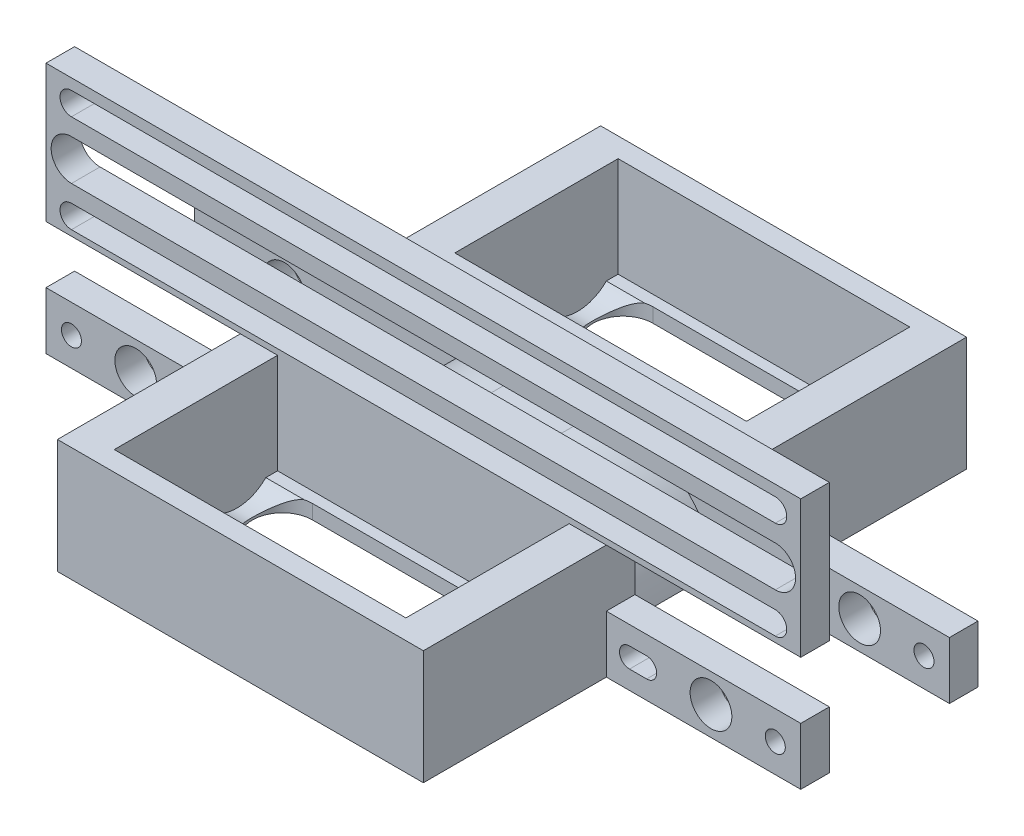
from build123d import *

# Parameters (mm, degrees)
SKETCH1_W                 = 51
SKETCH1_H                 = 28.56
TOTALHEIGHT_DEPTH         = 20
TOTALHEIGHT_2_DEPTH       = 20
SKETCH1_4_W               = 51
SKETCH1_4_H               = 21
MIDDLEFLOORHEIGHT_DEPTH   = 15
SKETCH1_3_W               = 51
SKETCH1_3_H               = 28.56
FLOORHEIGHT_DEPTH         = 2.5
DIPSFORBATTERY_REACH      = 135.406
SKETCH2_4_W               = 34
SKETCH2_4_H               = 10
SKETCH2_4_R               = 1.75
SKETCH2_4_R_2             = 3.65
MOUNTFORDRIVETRAIN_DEPTH  = 5
HOLESFORDRIVESHAFT_REACH  = 154.738
SKETCH2_R                 = 1.75
SKETCH2_R_2               = 3.65
FILLET1_R                 = 20
SLOTSFORPLASTICBARS_REACH = 154.738
SKETCH2_6_W               = 34
SKETCH2_6_H               = 10


with BuildPart() as part:
    # Sketch1 → TotalHeight (new body)
    with BuildSketch(Plane(origin=(0, 0, 0), x_dir=(1, 0, 0), z_dir=(0, 1, 0))):
        Polygon((34, 32), (34, 0), (98, 0), (98, 32), (132, 32), (132, 37), (0, 37), (0, 32), align=None)
        with Locations((66, 17.72)):
            Rectangle(SKETCH1_W, SKETCH1_H, mode=Mode.SUBTRACT)
    extrude(amount=TOTALHEIGHT_DEPTH)



with BuildPart() as body_2:
    # Sketch1 → TotalHeight 2 (new body)
    with BuildSketch(Plane(origin=(0, 0, 0), x_dir=(1, 0, 0), z_dir=(0, 1, 0))):
        Polygon((0, 63), (0, 58), (132, 58), (132, 63), (98, 63), (98, 95), (34, 95), (34, 63), align=None)
        with Locations((66, 77.28)):
            Rectangle(SKETCH1_W, SKETCH1_H, mode=Mode.SUBTRACT)
    extrude(amount=TOTALHEIGHT_2_DEPTH)


with BuildPart() as part_1:
    add(part.part)

    add(body_2.part)  # MiddleFloorHeight merges body 2
    # Sketch1<4> → MiddleFloorHeight (add)
    with BuildSketch(Plane(origin=(0, 0, 0), x_dir=(1, 0, 0), z_dir=(0, 1, 0))):
        with Locations((66, 47.5)):
            Rectangle(SKETCH1_4_W, SKETCH1_4_H)
    extrude(amount=MIDDLEFLOORHEIGHT_DEPTH)

    # Sketch1<3> → FloorHeight (add)
    # profile 1 of 2: a face of its own
    with BuildSketch(Plane(origin=(0, 0, 0), x_dir=(1, 0, 0), z_dir=(0, 1, 0))):
        with Locations((66, 77.28)):
            Rectangle(SKETCH1_3_W, SKETCH1_3_H)
        with BuildLine():
            ThreePointArc((83.5, 79.17), (88.75, 84.42), (83.5, 89.67))
            Line((83.5, 89.67), (48.5, 89.67))
            ThreePointArc((48.5, 89.67), (43.25, 84.42), (48.5, 79.17))
            Line((48.5, 79.17), (83.5, 79.17))
        make_face(mode=Mode.SUBTRACT)
        with BuildLine():
            Line((48.5, 75.39), (83.5, 75.39))
            ThreePointArc((83.5, 75.39), (88.75, 70.14), (83.5, 64.89))
            Line((83.5, 64.89), (48.5, 64.89))
            ThreePointArc((48.5, 64.89), (43.25, 70.14), (48.5, 75.39))
        make_face(mode=Mode.SUBTRACT)
    # profile 2 of 2: a face of its own
    with BuildSketch(Plane(origin=(0, 0, 0), x_dir=(1, 0, 0), z_dir=(0, 1, 0))):
        with Locations((66, 17.72)):
            Rectangle(SKETCH1_3_W, SKETCH1_3_H)
        with BuildLine():
            ThreePointArc((83.5, 19.61), (88.75, 24.86), (83.5, 30.11))
            Line((83.5, 30.11), (48.5, 30.11))
            ThreePointArc((48.5, 30.11), (43.25, 24.86), (48.5, 19.61))
            Line((48.5, 19.61), (83.5, 19.61))
        make_face(mode=Mode.SUBTRACT)
        with BuildLine():
            Line((48.5, 15.83), (83.5, 15.83))
            ThreePointArc((83.5, 15.83), (88.75, 10.58), (83.5, 5.33))
            Line((83.5, 5.33), (48.5, 5.33))
            ThreePointArc((48.5, 5.33), (43.25, 10.58), (48.5, 15.83))
        make_face(mode=Mode.SUBTRACT)
    extrude(amount=FLOORHEIGHT_DEPTH)

    # DipsForBattery: up to this face of the body (flat: up to its plane)
    dipsforbattery_end = Plane(part_1.part.faces().sort_by_distance((40.5, 11.25, -77.28))[0])
    # Sketch3 → DipsForBattery (cut, up to the picked face)
    with BuildSketch(Plane.ZY.offset(-91.5), mode=Mode.PRIVATE) as dipsforbattery_sk1:
        with BuildLine():
            ThreePointArc((-77.36, 7.5), (-87.163708918, 14.065055833), (-89.500833264, 2.5))
            Line((-89.500833264, 2.5), (-79.419166736, 2.5))
            ThreePointArc((-79.419166736, 2.5), (-77.894944167, 4.796291082), (-77.36, 7.5))
        make_face()
    dipsforbattery_tool1 = split(extrude(dipsforbattery_sk1.sketch, amount=DIPSFORBATTERY_REACH, mode=Mode.PRIVATE), bisect_by=dipsforbattery_end, keep=Keep.BOTH, mode=Mode.PRIVATE)
    # Sketch3 → DipsForBattery (cut, up to the picked face)
    with BuildSketch(Plane.ZY.offset(-91.5), mode=Mode.PRIVATE) as dipsforbattery_sk2:
        with BuildLine():
            Line((-79.419166736, 2.5), (-89.500833264, 2.5))
            ThreePointArc((-89.500833264, 2.5), (-84.46, 0.4), (-79.419166736, 2.5))
        make_face()
    dipsforbattery_tool2 = split(extrude(dipsforbattery_sk2.sketch, amount=DIPSFORBATTERY_REACH, mode=Mode.PRIVATE), bisect_by=dipsforbattery_end, keep=Keep.BOTH, mode=Mode.PRIVATE)
    # Sketch3 → DipsForBattery (cut, up to the picked face)
    with BuildSketch(Plane.ZY.offset(-91.5), mode=Mode.PRIVATE) as dipsforbattery_sk3:
        with BuildLine():
            ThreePointArc((-63, 7.5), (-72.803708918, 14.065055833), (-75.140833264, 2.5))
            Line((-75.140833264, 2.5), (-65.059166736, 2.5))
            ThreePointArc((-65.059166736, 2.5), (-63.534944167, 4.796291082), (-63, 7.5))
        make_face()
    dipsforbattery_tool3 = split(extrude(dipsforbattery_sk3.sketch, amount=DIPSFORBATTERY_REACH, mode=Mode.PRIVATE), bisect_by=dipsforbattery_end, keep=Keep.BOTH, mode=Mode.PRIVATE)
    # Sketch3 → DipsForBattery (cut, up to the picked face)
    with BuildSketch(Plane.ZY.offset(-91.5), mode=Mode.PRIVATE) as dipsforbattery_sk4:
        with BuildLine():
            Line((-65.059166736, 2.5), (-75.140833264, 2.5))
            ThreePointArc((-75.140833264, 2.5), (-70.1, 0.4), (-65.059166736, 2.5))
        make_face()
    dipsforbattery_tool4 = split(extrude(dipsforbattery_sk4.sketch, amount=DIPSFORBATTERY_REACH, mode=Mode.PRIVATE), bisect_by=dipsforbattery_end, keep=Keep.BOTH, mode=Mode.PRIVATE)
    # Sketch3 → DipsForBattery (cut, up to the picked face)
    with BuildSketch(Plane.ZY.offset(-91.5), mode=Mode.PRIVATE) as dipsforbattery_sk5:
        with BuildLine():
            ThreePointArc((-29.940833264, 2.5), (-24.9, 0.4), (-19.859166736, 2.5))
            Line((-19.859166736, 2.5), (-29.940833264, 2.5))
        make_face()
    dipsforbattery_tool5 = split(extrude(dipsforbattery_sk5.sketch, amount=DIPSFORBATTERY_REACH, mode=Mode.PRIVATE), bisect_by=dipsforbattery_end, keep=Keep.BOTH, mode=Mode.PRIVATE)
    # Sketch3 → DipsForBattery (cut, up to the picked face)
    with BuildSketch(Plane.ZY.offset(-91.5), mode=Mode.PRIVATE) as dipsforbattery_sk6:
        with BuildLine():
            Line((-29.940833264, 2.5), (-19.859166736, 2.5))
            ThreePointArc((-19.859166736, 2.5), (-18.334944167, 4.796291082), (-17.8, 7.5))
            ThreePointArc((-17.8, 7.5), (-27.603708918, 14.065055833), (-29.940833264, 2.5))
        make_face()
    dipsforbattery_tool6 = split(extrude(dipsforbattery_sk6.sketch, amount=DIPSFORBATTERY_REACH, mode=Mode.PRIVATE), bisect_by=dipsforbattery_end, keep=Keep.BOTH, mode=Mode.PRIVATE)
    # Sketch3 → DipsForBattery (cut, up to the picked face)
    with BuildSketch(Plane.ZY.offset(-91.5), mode=Mode.PRIVATE) as dipsforbattery_sk7:
        with BuildLine():
            ThreePointArc((-15.580833264, 2.5), (-10.54, 0.4), (-5.499166736, 2.5))
            Line((-5.499166736, 2.5), (-15.580833264, 2.5))
        make_face()
    dipsforbattery_tool7 = split(extrude(dipsforbattery_sk7.sketch, amount=DIPSFORBATTERY_REACH, mode=Mode.PRIVATE), bisect_by=dipsforbattery_end, keep=Keep.BOTH, mode=Mode.PRIVATE)
    # Sketch3 → DipsForBattery (cut, up to the picked face)
    with BuildSketch(Plane.ZY.offset(-91.5), mode=Mode.PRIVATE) as dipsforbattery_sk8:
        with BuildLine():
            Line((-15.580833264, 2.5), (-5.499166736, 2.5))
            ThreePointArc((-5.499166736, 2.5), (-3.974944167, 4.796291082), (-3.44, 7.5))
            ThreePointArc((-3.44, 7.5), (-13.243708918, 14.065055833), (-15.580833264, 2.5))
        make_face()
    dipsforbattery_tool8 = split(extrude(dipsforbattery_sk8.sketch, amount=DIPSFORBATTERY_REACH, mode=Mode.PRIVATE), bisect_by=dipsforbattery_end, keep=Keep.BOTH, mode=Mode.PRIVATE)
    add(dipsforbattery_tool1.solids().sort_by(Axis((91.5, 8.093926, -84.46), (-1, 0, 0)))[0], mode=Mode.SUBTRACT)
    add(dipsforbattery_tool2.solids().sort_by(Axis((91.5, 1.64835, -84.46), (-1, 0, 0)))[0], mode=Mode.SUBTRACT)
    add(dipsforbattery_tool3.solids().sort_by(Axis((91.5, 8.093926, -70.1), (-1, 0, 0)))[0], mode=Mode.SUBTRACT)
    add(dipsforbattery_tool4.solids().sort_by(Axis((91.5, 1.64835, -70.1), (-1, 0, 0)))[0], mode=Mode.SUBTRACT)
    add(dipsforbattery_tool5.solids().sort_by(Axis((91.5, 1.64835, -24.9), (-1, 0, 0)))[0], mode=Mode.SUBTRACT)
    add(dipsforbattery_tool6.solids().sort_by(Axis((91.5, 8.093926, -24.9), (-1, 0, 0)))[0], mode=Mode.SUBTRACT)
    add(dipsforbattery_tool7.solids().sort_by(Axis((91.5, 1.64835, -10.54), (-1, 0, 0)))[0], mode=Mode.SUBTRACT)
    add(dipsforbattery_tool8.solids().sort_by(Axis((91.5, 8.093926, -10.54), (-1, 0, 0)))[0], mode=Mode.SUBTRACT)

    # Sketch2<4> → MountForDriveTrain (add)
    # profile 1 of 4: a face of its own
    with BuildSketch(Plane.XY.offset(-32)):
        Polygon((0, 44), (0, 20), (34, 20), (98, 20), (132, 20), (132, 44), align=None)
        with BuildLine():
            ThreePointArc((4.45, 28), (0.9, 31.55), (4.45, 35.1))
            Line((4.45, 35.1), (127.55, 35.1))
            ThreePointArc((127.55, 35.1), (131.1, 31.55), (127.55, 28))
            Line((127.55, 28), (4.45, 28))
        make_face(mode=Mode.SUBTRACT)
        with BuildLine():
            ThreePointArc((4.45, 21), (2.45, 23), (4.45, 25))
            Line((4.45, 25), (127.55, 25))
            ThreePointArc((127.55, 25), (129.55, 23), (127.55, 21))
            Line((127.55, 21), (4.45, 21))
        make_face(mode=Mode.SUBTRACT)
        with BuildLine():
            ThreePointArc((4.45, 38.1), (2.45, 40.1), (4.45, 42.1))
            Line((4.45, 42.1), (127.55, 42.1))
            ThreePointArc((127.55, 42.1), (129.55, 40.1), (127.55, 38.1))
            Line((127.55, 38.1), (4.45, 38.1))
        make_face(mode=Mode.SUBTRACT)
    # profile 2 of 4: a face of its own
    with BuildSketch(Plane.XY.offset(-32)):
        with Locations((17, 15)):
            Rectangle(SKETCH2_4_W, SKETCH2_4_H)
    # profile 3 of 4: a face of its own
    with BuildSketch(Plane.XY.offset(-32)):
        Polygon((98, 20), (34, 20), (34, 10), (0, 10), (0, 0), (132, 0), (132, 10), (98, 10), align=None)
        with Locations((4.45, 5)):
            Circle(SKETCH2_4_R, mode=Mode.SUBTRACT)
        with Locations((15.7, 5)):
            Circle(SKETCH2_4_R_2, mode=Mode.SUBTRACT)
        with BuildLine():
            ThreePointArc((26.95, 3.25), (25.2, 5), (26.95, 6.75))
            Line((26.95, 6.75), (29.95, 6.75))
            ThreePointArc((29.95, 6.75), (31.7, 5), (29.95, 3.25))
            Line((29.95, 3.25), (26.95, 3.25))
        make_face(mode=Mode.SUBTRACT)
        with BuildLine():
            Line((102.05, 6.75), (105.05, 6.75))
            ThreePointArc((105.05, 6.75), (106.8, 5), (105.05, 3.25))
            Line((105.05, 3.25), (102.05, 3.25))
            ThreePointArc((102.05, 3.25), (100.3, 5), (102.05, 6.75))
        make_face(mode=Mode.SUBTRACT)
        with Locations((116.3, 5)):
            Circle(SKETCH2_4_R_2, mode=Mode.SUBTRACT)
        with Locations((127.55, 5)):
            Circle(SKETCH2_4_R, mode=Mode.SUBTRACT)
    # profile 4 of 4: a face of its own
    with BuildSketch(Plane.XY.offset(-32)):
        with Locations((115, 15)):
            Rectangle(SKETCH2_4_W, SKETCH2_4_H)
    extrude(amount=-MOUNTFORDRIVETRAIN_DEPTH)

    # HolesForDriveShaft: up to this face of the body (flat: up to its plane)
    holesfordriveshaft_end = Plane(part_1.part.faces().sort_by_distance((115, 10, -63))[0])
    # Sketch2 → HolesForDriveShaft (cut, up to the picked face)
    with BuildSketch(Plane.XY.offset(-32), mode=Mode.PRIVATE) as holesfordriveshaft_sk1:
        with Locations(Location((4.45, 5, 0), (0, 0, 180))):
            Circle(SKETCH2_R)
    holesfordriveshaft_tool1 = split(extrude(holesfordriveshaft_sk1.sketch, amount=-HOLESFORDRIVESHAFT_REACH, mode=Mode.PRIVATE), bisect_by=holesfordriveshaft_end, keep=Keep.BOTH, mode=Mode.PRIVATE)
    # Sketch2 → HolesForDriveShaft (cut, up to the picked face)
    with BuildSketch(Plane.XY.offset(-32), mode=Mode.PRIVATE) as holesfordriveshaft_sk2:
        with Locations(Location((15.7, 5, 0), (0, 0, 180))):
            Circle(SKETCH2_R_2)
    holesfordriveshaft_tool2 = split(extrude(holesfordriveshaft_sk2.sketch, amount=-HOLESFORDRIVESHAFT_REACH, mode=Mode.PRIVATE), bisect_by=holesfordriveshaft_end, keep=Keep.BOTH, mode=Mode.PRIVATE)
    # Sketch2 → HolesForDriveShaft (cut, up to the picked face)
    with BuildSketch(Plane.XY.offset(-32), mode=Mode.PRIVATE) as holesfordriveshaft_sk3:
        with BuildLine():
            Line((26.95, 3.25), (29.95, 3.25))
            ThreePointArc((29.95, 3.25), (31.7, 5), (29.95, 6.75))
            Line((29.95, 6.75), (26.95, 6.75))
            ThreePointArc((26.95, 6.75), (25.2, 5), (26.95, 3.25))
        make_face()
    holesfordriveshaft_tool3 = split(extrude(holesfordriveshaft_sk3.sketch, amount=-HOLESFORDRIVESHAFT_REACH, mode=Mode.PRIVATE), bisect_by=holesfordriveshaft_end, keep=Keep.BOTH, mode=Mode.PRIVATE)
    # Sketch2 → HolesForDriveShaft (cut, up to the picked face)
    with BuildSketch(Plane.XY.offset(-32), mode=Mode.PRIVATE) as holesfordriveshaft_sk4:
        with BuildLine():
            ThreePointArc((102.05, 3.25), (100.3, 5), (102.05, 6.75))
            Line((102.05, 6.75), (105.05, 6.75))
            ThreePointArc((105.05, 6.75), (106.8, 5), (105.05, 3.25))
            Line((105.05, 3.25), (102.05, 3.25))
        make_face()
    holesfordriveshaft_tool4 = split(extrude(holesfordriveshaft_sk4.sketch, amount=-HOLESFORDRIVESHAFT_REACH, mode=Mode.PRIVATE), bisect_by=holesfordriveshaft_end, keep=Keep.BOTH, mode=Mode.PRIVATE)
    # Sketch2 → HolesForDriveShaft (cut, up to the picked face)
    with BuildSketch(Plane.XY.offset(-32), mode=Mode.PRIVATE) as holesfordriveshaft_sk5:
        with Locations(Location((116.3, 5, 0), (0, 0, 180))):
            Circle(SKETCH2_R_2)
    holesfordriveshaft_tool5 = split(extrude(holesfordriveshaft_sk5.sketch, amount=-HOLESFORDRIVESHAFT_REACH, mode=Mode.PRIVATE), bisect_by=holesfordriveshaft_end, keep=Keep.BOTH, mode=Mode.PRIVATE)
    # Sketch2 → HolesForDriveShaft (cut, up to the picked face)
    with BuildSketch(Plane.XY.offset(-32), mode=Mode.PRIVATE) as holesfordriveshaft_sk6:
        with Locations(Location((127.55, 5, 0), (0, 0, 180))):
            Circle(SKETCH2_R)
    holesfordriveshaft_tool6 = split(extrude(holesfordriveshaft_sk6.sketch, amount=-HOLESFORDRIVESHAFT_REACH, mode=Mode.PRIVATE), bisect_by=holesfordriveshaft_end, keep=Keep.BOTH, mode=Mode.PRIVATE)
    add(holesfordriveshaft_tool1.solids().sort_by(Axis((4.45, 5, -32), (0, 0, -1)))[0], mode=Mode.SUBTRACT)
    add(holesfordriveshaft_tool2.solids().sort_by(Axis((15.7, 5, -32), (0, 0, -1)))[0], mode=Mode.SUBTRACT)
    add(holesfordriveshaft_tool3.solids().sort_by(Axis((28.45, 5, -32), (0, 0, -1)))[0], mode=Mode.SUBTRACT)
    add(holesfordriveshaft_tool4.solids().sort_by(Axis((103.55, 5, -32), (0, 0, -1)))[0], mode=Mode.SUBTRACT)
    add(holesfordriveshaft_tool5.solids().sort_by(Axis((116.3, 5, -32), (0, 0, -1)))[0], mode=Mode.SUBTRACT)
    add(holesfordriveshaft_tool6.solids().sort_by(Axis((127.55, 5, -32), (0, 0, -1)))[0], mode=Mode.SUBTRACT)

    # Fillet1
    # the kernel refuses this fillet: 20 mm, written as the material it takes off along each edge
    with BuildSketch(Plane(origin=(40.5, 15, -58), x_dir=(0, -1, 0), z_dir=(0, 0, 1))) as fillet1_piece_1:
        with BuildLine():
            CenterArc((20, 19.364916731), FILLET1_R, 180, 75.522487814)
            Line((0, 19.364916731), (-0.4, 19.364916731))
            Line((-0.4, 19.364916731), (-0.4, 0))
            Line((-0.4, 0), (0, -0.4))
            ThreePointArc((0, -0.4), (7.5, -0.4), (14.9, -0.387298335))
            Line((14.9, -0.387298335), (15, 0))
        make_face()
    extrude(amount=21, mode=Mode.SUBTRACT)
    with BuildSketch(Plane(origin=(91.5, 15, -37), x_dir=(-1, 0, 0), z_dir=(0, 0, -1))) as fillet1_piece_2:
        with BuildLine():
            CenterArc((19.364916731, -20), FILLET1_R, 90, 75.522487814)
            Line((0, -15), (-0.387298335, -14.9))
            ThreePointArc((-0.387298335, -14.9), (-0.4, -7.5), (-0.4, 0))
            Line((-0.4, 0), (0, 0.4))
            Line((0, 0.4), (19.364916731, 0.4))
            Line((19.364916731, 0.4), (19.364916731, 0))
        make_face()
    extrude(amount=21, mode=Mode.SUBTRACT)

    # SlotsForPlasticBars: up to this face of the body (flat: up to its plane)
    slotsforplasticbars_end = Plane(part_1.part.faces().sort_by_distance((16.90921864, 10.588393055, -63))[0])
    # Sketch2<6> → SlotsForPlasticBars (cut, up to the picked face)
    with BuildSketch(Plane.XY.offset(-32), mode=Mode.PRIVATE) as slotsforplasticbars_sk1:
        with Locations((115, 15)):
            Rectangle(SKETCH2_6_W, SKETCH2_6_H)
    slotsforplasticbars_tool1 = split(extrude(slotsforplasticbars_sk1.sketch, amount=-SLOTSFORPLASTICBARS_REACH, mode=Mode.PRIVATE), bisect_by=slotsforplasticbars_end, keep=Keep.BOTH, mode=Mode.PRIVATE)
    # Sketch2<6> → SlotsForPlasticBars (cut, up to the picked face)
    with BuildSketch(Plane.XY.offset(-32), mode=Mode.PRIVATE) as slotsforplasticbars_sk2:
        with Locations((17, 15)):
            Rectangle(SKETCH2_6_W, SKETCH2_6_H)
    slotsforplasticbars_tool2 = split(extrude(slotsforplasticbars_sk2.sketch, amount=-SLOTSFORPLASTICBARS_REACH, mode=Mode.PRIVATE), bisect_by=slotsforplasticbars_end, keep=Keep.BOTH, mode=Mode.PRIVATE)
    add(slotsforplasticbars_tool1.solids().sort_by(Axis((115, 15, -32), (0, 0, -1)))[0], mode=Mode.SUBTRACT)
    add(slotsforplasticbars_tool2.solids().sort_by(Axis((17, 15, -32), (0, 0, -1)))[0], mode=Mode.SUBTRACT)


solid = part_1.part
